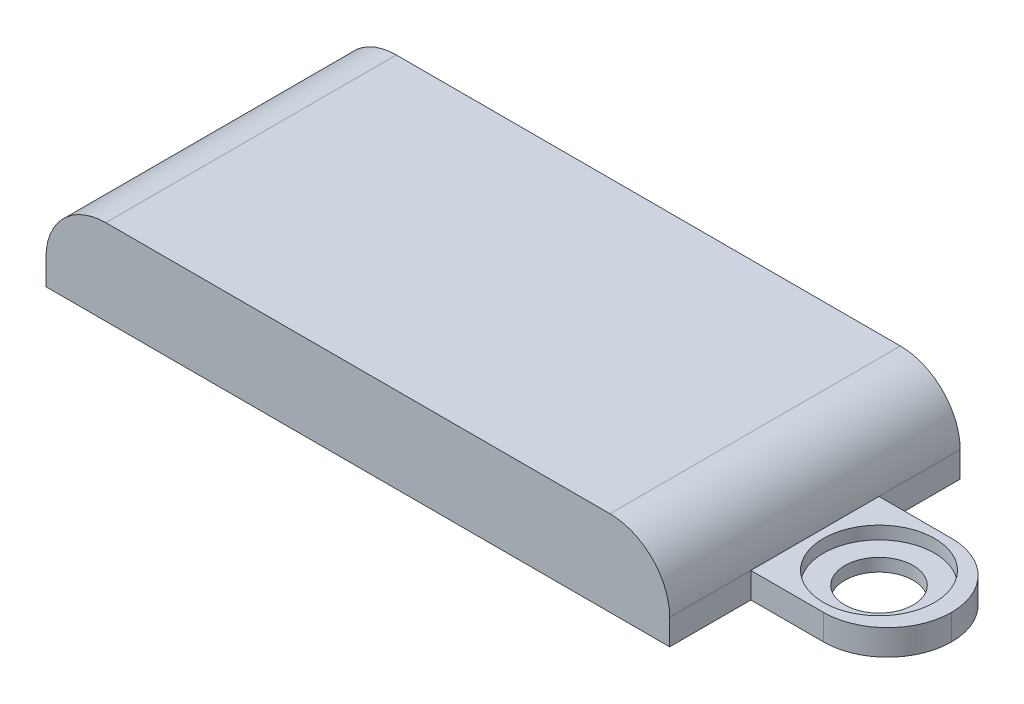
from build123d import *

# Parameters (mm, degrees)
SKETCH1_W          = 73
SKETCH1_H          = 34
BASE_DEPTH         = 10
SKETCH3_W          = 70
SKETCH3_H          = 31
INSIDE_CUT_DEPTH   = 8.5
INSIDE_FILLET_R    = 5.5
OUTSIDE_FILLET_R   = 7
SKETCH4_W          = 16
SKETCH4_H          = 15
SCREW_SQUARE_DEPTH = 3
SCREW_FILLET_R     = 7.5
SKETCH5_R          = 4
CUT_EXTRUDE3_DEPTH = 3
SKETCH7_R          = 6.5
CUT_EXTRUDE4_DEPTH = 1.5


with BuildPart() as part:
    # Sketch1 → base (new body)
    with BuildSketch(Plane(origin=(0, 0, 0), x_dir=(1, 0, 0), z_dir=(0, 1, 0))):
        with Locations((3.513975155, -1.64052795)):
            Rectangle(SKETCH1_W, SKETCH1_H)
    extrude(amount=BASE_DEPTH)

    # Sketch3 → inside cut (cut)
    with BuildSketch(Plane.XZ):
        with Locations((3.513975155, 1.64052795)):
            Rectangle(SKETCH3_W, SKETCH3_H)
    extrude(amount=-INSIDE_CUT_DEPTH, mode=Mode.SUBTRACT)

    # inside fillet
    inside_fillet_edges = [part.edges().sort_by_distance(p)[0] for p in [
        (-31.486024845, 8.5, 1.64052795),
        (38.513975155, 8.5, 1.64052795),
    ]]
    fillet(inside_fillet_edges, radius=INSIDE_FILLET_R)

    # outside fillet
    outside_fillet_edges = [part.edges().sort_by_distance(p)[0] for p in [
        (40.013975155, 10, 1.64052795),
        (-32.986024845, 10, 1.64052795),
    ]]
    fillet(outside_fillet_edges, radius=OUTSIDE_FILLET_R)

    # Sketch4 → screw square (add)
    with BuildSketch(Plane.XZ):
        with Locations((48.013975155, 1.64052795)):
            Rectangle(SKETCH4_W, SKETCH4_H)
    extrude(amount=-SCREW_SQUARE_DEPTH)

    # screw fillet
    screw_fillet_edges = [part.edges().sort_by_distance(p)[0] for p in [
        (56.013975155, 1.5, -5.85947205),
        (56.013975155, 1.5, 9.14052795),
    ]]
    fillet(screw_fillet_edges, radius=SCREW_FILLET_R - 0.0001)  # a hair under: the kernel refuses the full size

    # Sketch5 → Cut-Extrude3 (cut)
    with BuildSketch(Plane(origin=(0, 3, 0), x_dir=(1, 0, 0), z_dir=(0, 1, 0))):
        with Locations(Location((47.513975155, -1.64052795, 0), (0, 0, 270))):
            Circle(SKETCH5_R)
    extrude(amount=-CUT_EXTRUDE3_DEPTH, mode=Mode.SUBTRACT)

    # Sketch7 → Cut-Extrude4 (cut)
    with BuildSketch(Plane(origin=(0, 3, 0), x_dir=(1, 0, 0), z_dir=(0, 1, 0))):
        with Locations(Location((47.513975155, -1.64052795, 0), (0, 0, 270))):
            Circle(SKETCH7_R)
    extrude(amount=-CUT_EXTRUDE4_DEPTH, mode=Mode.SUBTRACT)


solid = part.part
